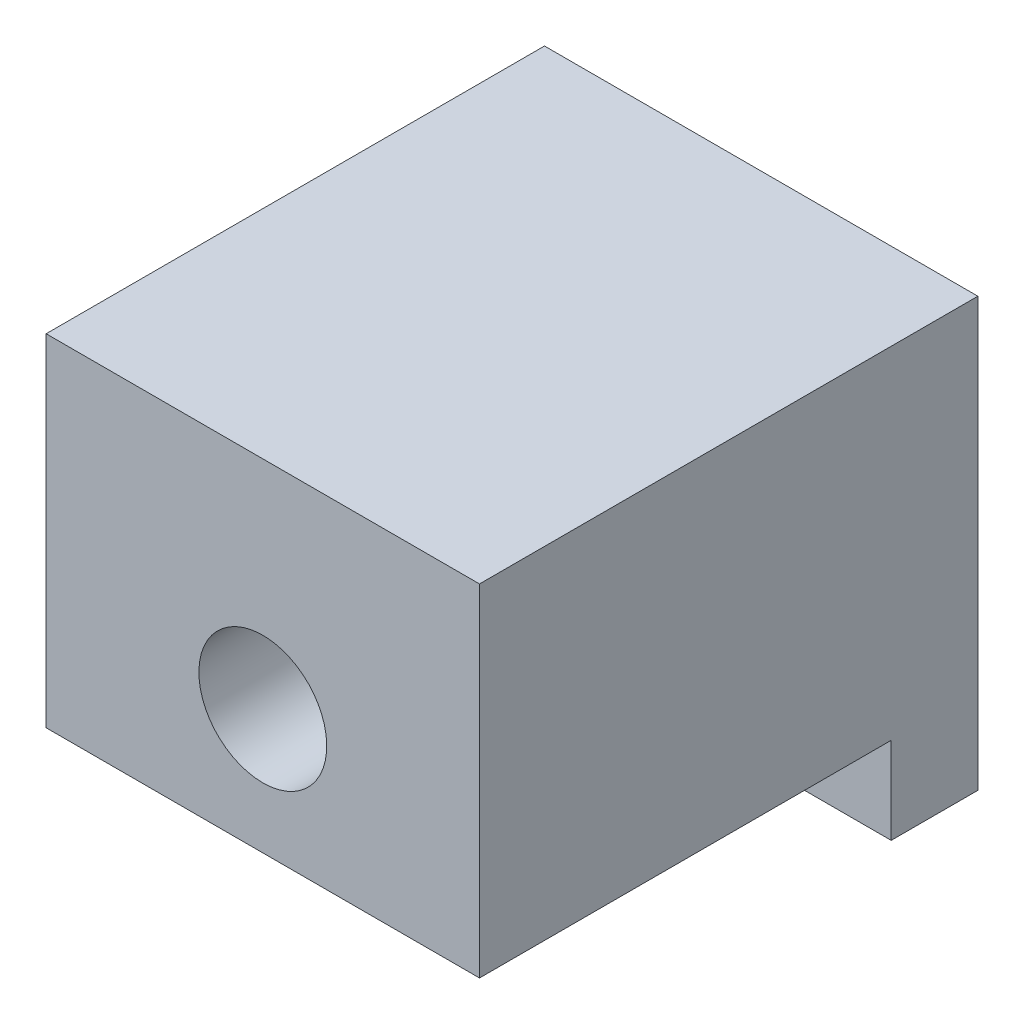
from build123d import *

# Parameters (mm, degrees)
SKETCH1_W                    = 10
SKETCH1_H                    = 70
BOSS_EXTRUDE1_DEPTH          = 9.5
SKETCH2_W                    = 54.25
SKETCH2_H                    = 9.5
CUT_EXTRUDE1_DEPTH           = 38.619808612
SKETCH3_R                    = 1.475
CUT_EXTRUDE2_DEPTH           = 37.609425016
SKETCH4_W                    = 10
SKETCH4_H                    = 9.875
SKETCH4_R                    = 1.475
BOSS_EXTRUDE2_DEPTH          = 2
BODY_DELETE_KEEP_2_OUTLINE_W = 10
BODY_DELETE_KEEP_2_OUTLINE_H = 9.875
BODY_DELETE_KEEP_2_OUTLINE_R = 1.475
BODY_DELETE_KEEP_2_DEPTH     = 11.5
BODY_MOVE_COPY1_ANGLE        = 90


with BuildPart() as part:
    # Sketch1 → Boss-Extrude1 (new body)
    with BuildSketch(Plane(origin=(0, 0, 0), x_dir=(1, 0, 0), z_dir=(0, 1, 0))):
        Rectangle(SKETCH1_W, SKETCH1_H)
    extrude(amount=BOSS_EXTRUDE1_DEPTH)

    # Sketch2 → Cut-Extrude1 (cut, through all)
    with BuildSketch(Plane(origin=(5, 0, 0), x_dir=(0, 0, -1), z_dir=(1, 0, 0))):
        with Locations((0, 4.75)):
            Rectangle(SKETCH2_W, SKETCH2_H)
    extrude(amount=-CUT_EXTRUDE1_DEPTH, mode=Mode.SUBTRACT)


with BuildPart() as cut_extrude1_piece_1:
    # of the separate pieces the step leaves, piece 1, a body of its own (cut_extrude1_pieces)
    add(part.part.solids().sort_by_distance((-5, 0, 35))[0])


with BuildPart() as cut_extrude1_piece_2:
    # of the separate pieces the step leaves, piece 2, a body of its own (cut_extrude1_pieces)
    add(part.part.solids().sort_by_distance((-5, 0, -35))[0])


with BuildPart() as cut_extrude2_tool:
    # Sketch3 → Cut-Extrude2 (new, through all)
    with BuildSketch(Plane.XZ):
        with Locations(Location((0, 30, 0), (0, 0, 270))):
            Circle(SKETCH3_R)
        with Locations(Location((0, -30, 0), (0, 0, 270))):
            Circle(SKETCH3_R)
    extrude(amount=-CUT_EXTRUDE2_DEPTH)


with BuildPart() as cut_extrude1_piece_1_1:
    add(cut_extrude1_piece_1.part)

    # Cut-Extrude2: cut by cut_extrude2_tool
    add(cut_extrude2_tool.part, mode=Mode.SUBTRACT)



with BuildPart() as cut_extrude1_piece_2_1:
    add(cut_extrude1_piece_2.part)

    # Cut-Extrude2: cut by cut_extrude2_tool
    add(cut_extrude2_tool.part, mode=Mode.SUBTRACT)


with BuildPart() as cut_extrude1_piece_1_2:
    add(cut_extrude1_piece_1_1.part)

    add(cut_extrude1_piece_2_1.part)  # Boss-Extrude2 merges Cut-Extrude1 piece 2
    # Sketch4 → Boss-Extrude2 (add)
    # profile 1 of 2: a face of its own
    with BuildSketch(Plane(origin=(0, 9.5, 0), x_dir=(1, 0, 0), z_dir=(0, 1, 0))):
        with Locations((0, -30.0625)):
            Rectangle(SKETCH4_W, SKETCH4_H)
        with Locations(Location((0, -30, 0), (0, 0, 90))):
            Circle(SKETCH4_R, mode=Mode.SUBTRACT)
    # profile 2 of 2: a face of its own
    with BuildSketch(Plane(origin=(0, 9.5, 0), x_dir=(1, 0, 0), z_dir=(0, 1, 0))):
        with Locations((0, 30.0625)):
            Rectangle(SKETCH4_W, SKETCH4_H)
        with Locations(Location((0, 30, 0), (0, 0, 90))):
            Circle(SKETCH4_R, mode=Mode.SUBTRACT)
    extrude(amount=BOSS_EXTRUDE2_DEPTH)

    # Body-Delete/Keep 2: read off the stored shape, not the designer's step
    # Body-Delete/Keep 2 outline → Body-Delete/Keep 2 (cut)
    with BuildSketch(Plane(origin=(0, 0, 0), x_dir=(1, 0, 0), z_dir=(0, 1, 0))):
        with Locations((0, 30.0625)):
            Rectangle(BODY_DELETE_KEEP_2_OUTLINE_W, BODY_DELETE_KEEP_2_OUTLINE_H)
        with Locations((0, 30)):
            Circle(BODY_DELETE_KEEP_2_OUTLINE_R, mode=Mode.SUBTRACT)
    extrude(amount=BODY_DELETE_KEEP_2_DEPTH, mode=Mode.SUBTRACT)


with BuildPart() as cut_extrude1_piece_1_3:
    # Body-Move/Copy1: read off the stored shape, not the designer's step
    # Body-Move/Copy1: moved
    add(cut_extrude1_piece_1_2.part.moved(Location((0, -11.5, 11.5))).rotate(Axis((0, 0, 0), (-1, 0, 0)), BODY_MOVE_COPY1_ANGLE))


solid = cut_extrude1_piece_1_3.part
